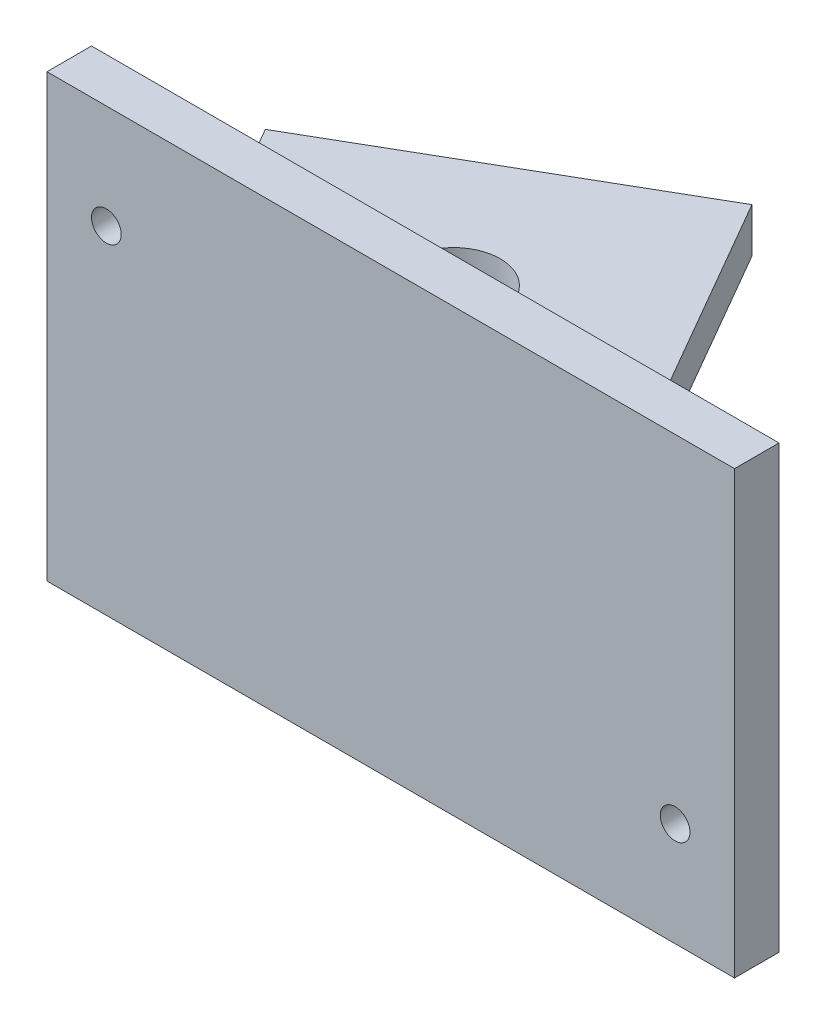
from build123d import *

# Parameters (mm, degrees)
SKETCH1_W           = 36.7665
SKETCH1_H           = 21.209
SKETCH1_R           = 0.79375
BOSS_EXTRUDE1_DEPTH = 2.38125
BOSS_EXTRUDE3_DEPTH = 2.38125
CUT_EXTRUDE2_REACH  = 53.908
SKETCH4_R           = 2.4892


with BuildPart() as part:
    # Sketch1 → Boss-Extrude1 (new body)
    with BuildSketch(Plane.XY):
        with Locations((16.98625, 9.2075)):
            Rectangle(SKETCH1_W, SKETCH1_H)
        with Locations((1.778, 14.25575)):
            Circle(SKETCH1_R, mode=Mode.SUBTRACT)
        with Locations((32.1945, 1.778)):
            Circle(SKETCH1_R, mode=Mode.SUBTRACT)
    extrude(amount=BOSS_EXTRUDE1_DEPTH)

    # Sketch2 → Boss-Extrude3 (add)
    with BuildSketch(Plane.XZ.offset(1.397)):
        Polygon((-1.397, 2.38125), (35.3695, 2.38125), (35.3695, 0), (20.600045256, 0), (2.400783942, -31.522045256), (-14.097, -21.997045256), (-1.397, 0), align=None)
    extrude(amount=BOSS_EXTRUDE3_DEPTH)

    # Sketch4 → Cut-Extrude2 (cut, up to next)
    with BuildSketch(Plane(origin=(0, -1.397, 0), x_dir=(1, 0, 0), z_dir=(0, 1, 0)), mode=Mode.PRIVATE) as cut_extrude2_sk1:
        with Locations((-1.828477372, 19.797340731)):
            Circle(SKETCH4_R)
    cut_extrude2_tool1 = extrude(cut_extrude2_sk1.sketch, amount=-CUT_EXTRUDE2_REACH, mode=Mode.PRIVATE) & part.part
    # Sketch4 → Cut-Extrude2 (cut, up to next)
    with BuildSketch(Plane(origin=(0, -1.397, 0), x_dir=(1, 0, 0), z_dir=(0, 1, 0)), mode=Mode.PRIVATE) as cut_extrude2_sk2:
        with Locations((4.521522628, 8.798818102)):
            Circle(SKETCH4_R)
    cut_extrude2_tool2 = extrude(cut_extrude2_sk2.sketch, amount=-CUT_EXTRUDE2_REACH, mode=Mode.PRIVATE) & part.part
    add(cut_extrude2_tool1.solids().sort_by_distance((-1.828477, -1.397, -19.797341))[0], mode=Mode.SUBTRACT)
    add(cut_extrude2_tool2.solids().sort_by_distance((4.521523, -1.397, -8.798818))[0], mode=Mode.SUBTRACT)


solid = part.part
